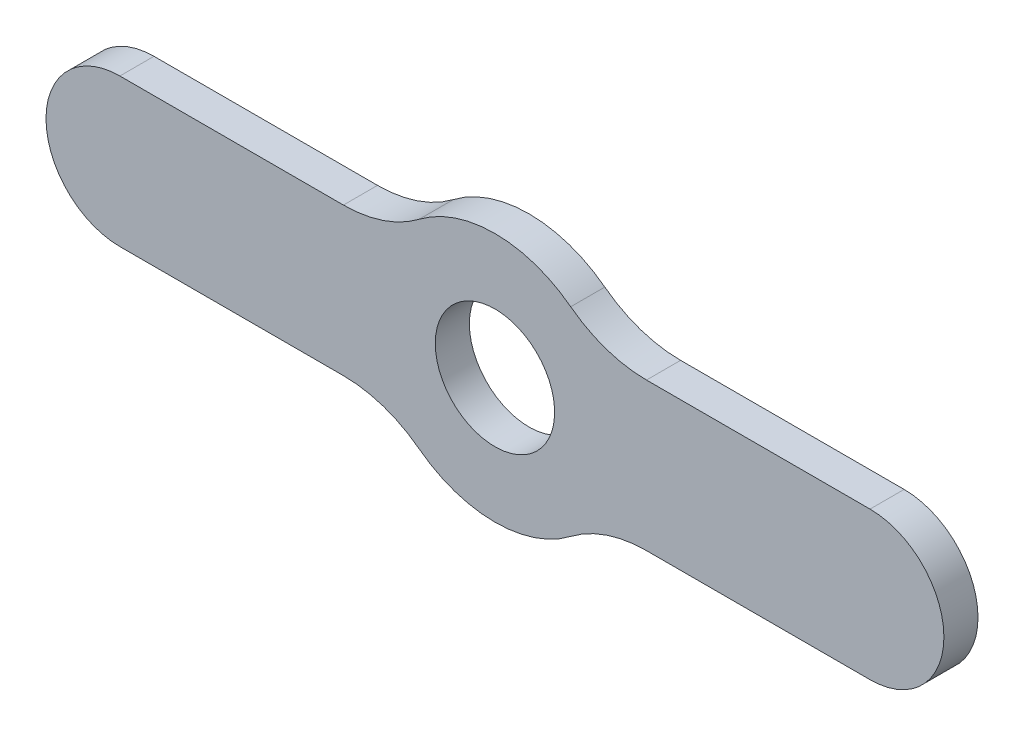
from build123d import *

# Parameters (mm, degrees)
FLANGE_BASE1_DEPTH    = 3
FILETE1_R             = 11
FILETE2_R             = 11
CORTE_EXTRUS_O1_REACH = 43.113
ESBO_O2_R             = 5.25


# Sheet-metal steps are written as plain solids
with BuildPart() as part:
    # Esboço1 → Flange-base1 (new body)
    with BuildSketch(Plane.XY):
        with BuildLine():
            Line((-33, 6.5), (-8.874119675, 6.5))
            ThreePointArc((-8.874119675, 6.5), (-4.974937186, 9.810708435), (0, 11))
            ThreePointArc((0, 11), (4.974937186, 9.810708435), (8.874119675, 6.5))
            Line((8.874119675, 6.5), (33, 6.5))
            ThreePointArc((33, 6.5), (39.5, 0), (33, -6.5))
            Line((33, -6.5), (8.874119675, -6.5))
            ThreePointArc((8.874119675, -6.5), (4.974937186, -9.810708435), (0, -11))
            ThreePointArc((0, -11), (-4.974937186, -9.810708435), (-8.874119675, -6.5))
            Line((-8.874119675, -6.5), (-33, -6.5))
            ThreePointArc((-33, -6.5), (-39.5, 0), (-33, 6.5))
        make_face()
    extrude(amount=-FLANGE_BASE1_DEPTH)

    # Filete1
    filete1_edges = [part.edges().sort_by_distance(p)[0] for p in [
        (-8.874119675, 6.5, -1.5),
    ]]
    fillet(filete1_edges, radius=FILETE1_R)

    # Filete2
    filete2_edges = [part.edges().sort_by_distance(p)[0] for p in [
        (8.874119675, -6.5, -1.5),
        (-8.874119675, -6.5, -1.5),
        (8.874119675, 6.5, -1.5),
    ]]
    fillet(filete2_edges, radius=FILETE2_R)

    # Esboço2 → Corte-extrusão1 (cut, up to next)
    with BuildSketch(Plane(origin=(0, 0, -3), x_dir=(-1, 0, 0), z_dir=(0, 0, -1)), mode=Mode.PRIVATE) as corte_extrus_o1_sk1:
        Circle(ESBO_O2_R)
    corte_extrus_o1_tool1 = extrude(corte_extrus_o1_sk1.sketch, amount=-CORTE_EXTRUS_O1_REACH, mode=Mode.PRIVATE) & part.part
    add(corte_extrus_o1_tool1.solids().sort_by_distance((0, 0, -3))[0], mode=Mode.SUBTRACT)


solid = part.part
